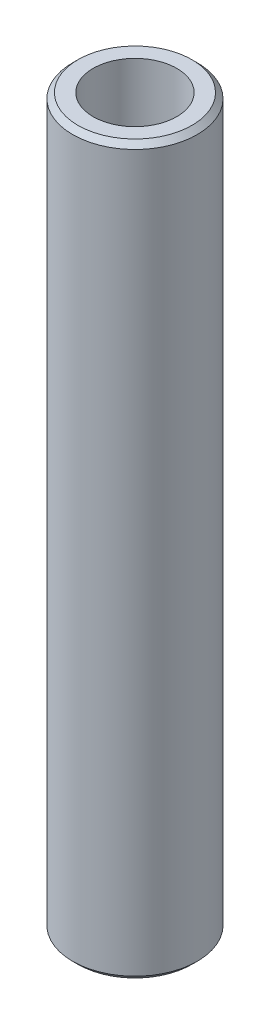
from build123d import *

# Parameters (mm, degrees)
SKETCH1_R           = 42.5
BOSS_EXTRUDE1_DEPTH = 495.734391088
SKETCH2_R           = 28.558075059
CUT_EXTRUDE1_DEPTH  = 500.364682879
CHAMFER1_SIZE       = 3.626587213


with BuildPart() as part:
    # Sketch1 → Boss-Extrude1 (new body)
    with BuildSketch(Plane(origin=(0, 0, 0), x_dir=(1, 0, 0), z_dir=(0, 1, 0))):
        Circle(SKETCH1_R)
    extrude(amount=BOSS_EXTRUDE1_DEPTH)

    # Sketch2 → Cut-Extrude1 (cut, through all)
    with BuildSketch(Plane(origin=(0, 0, 0), x_dir=(1, 0, 0), z_dir=(0, 1, 0))):
        Circle(SKETCH2_R)
    extrude(amount=CUT_EXTRUDE1_DEPTH, mode=Mode.SUBTRACT)

    # Chamfer1
    chamfer1_edges = [part.edges().sort_by_distance(p)[0] for p in [
        (-42.5, 495.734391088, 0),
        (-42.5, 0, 0),
    ]]
    chamfer(chamfer1_edges, length=CHAMFER1_SIZE)


solid = part.part
